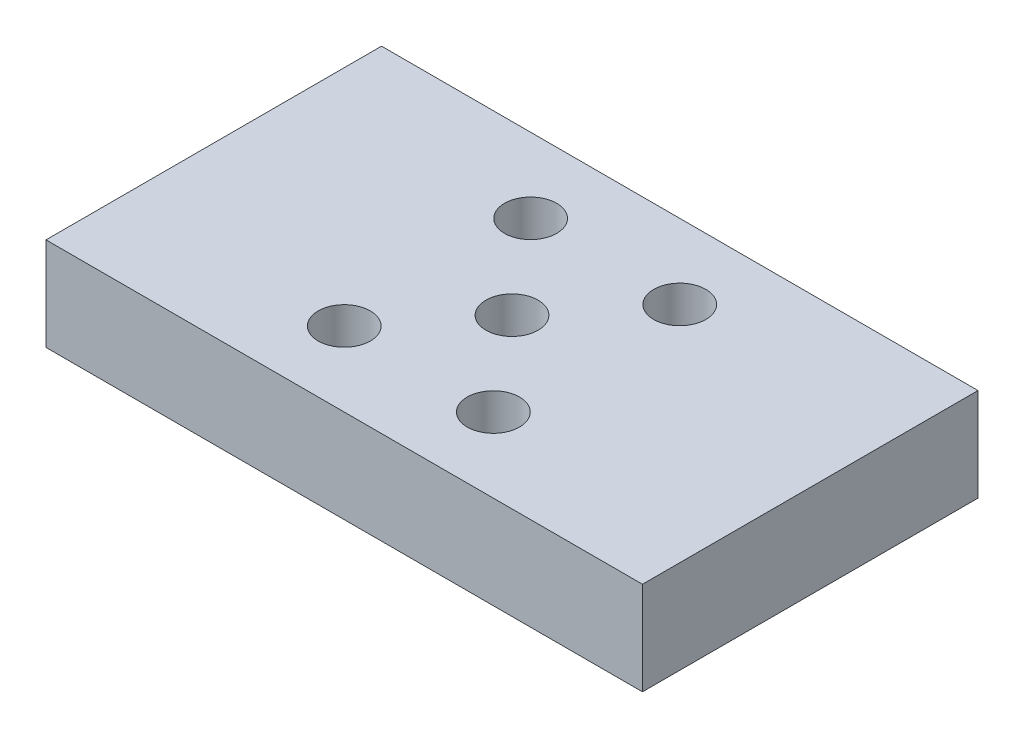
from build123d import *

# Parameters (mm, degrees)
SKETCH1_W           = 32
SKETCH1_H           = 18
SKETCH1_R           = 1.4
BOSS_EXTRUDE1_DEPTH = 5


with BuildPart() as part:
    # Sketch1 → Boss-Extrude1 (new body)
    with BuildSketch(Plane(origin=(0, 0, 0), x_dir=(1, 0, 0), z_dir=(0, 1, 0))):
        with Locations((16, 9)):
            Rectangle(SKETCH1_W, SKETCH1_H)
        with Locations((12, 4)):
            Circle(SKETCH1_R, mode=Mode.SUBTRACT)
        with Locations((20, 4)):
            Circle(SKETCH1_R, mode=Mode.SUBTRACT)
        with Locations((20, 14)):
            Circle(SKETCH1_R, mode=Mode.SUBTRACT)
        with Locations((12, 14)):
            Circle(SKETCH1_R, mode=Mode.SUBTRACT)
        with Locations((16, 9)):
            Circle(SKETCH1_R, mode=Mode.SUBTRACT)
    extrude(amount=BOSS_EXTRUDE1_DEPTH)


solid = part.part
